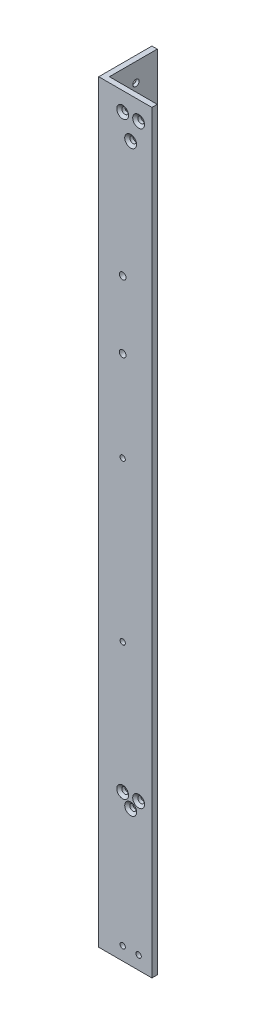
from build123d import *

# Parameters (mm, degrees)
BOSS_EXTRUDE1_DEPTH                               = 450
FRONTSIDEHOLES_SKETCH3_R                          = 1.5875
FRONTSIDEHOLES_SKETCH3_R_2                        = 2
FRONTSIDEHOLES_CUT_EXTRUDE1_DEPTH                 = 3.175
LEFTSIDEHOLES_SKETCH4_R                           = 1.5875
LEFTSIDEHOLES_CUT_EXTRUDE2_DEPTH                  = 3.175
CSK_FOR_6_FLAT_HEAD_MACHINE_SCREW_100_D           = 3.7973
CSK_FOR_6_FLAT_HEAD_MACHINE_SCREW_100_CSINK_D     = 7.0866
CSK_FOR_6_FLAT_HEAD_MACHINE_SCREW_100_CSINK_ANGLE = 100
CSK_FOR_6_FLAT_HEAD_MACHINE_SCREW_2_D             = 3.7973
CSK_FOR_6_FLAT_HEAD_MACHINE_SCREW_2_CSINK_D       = 7.0866
CSK_FOR_6_FLAT_HEAD_MACHINE_SCREW_2_CSINK_ANGLE   = 100


with BuildPart() as part:
    # Sketch2 → Boss-Extrude1 (new body)
    with BuildSketch(Plane(origin=(0, 0, 0), x_dir=(1, 0, 0), z_dir=(0, 1, 0))):
        Polygon((0, 31.75), (3.175, 31.75), (3.175, 3.175), (31.75, 3.175), (31.75, 0), (0, 0), align=None)
    extrude(amount=BOSS_EXTRUDE1_DEPTH)

    # FrontSideHoles-Sketch3 → FrontSideHoles-Cut-Extrude1 (cut)
    with BuildSketch(Plane.XY):
        with Locations((19.05, 81.1125)):
            Circle(FRONTSIDEHOLES_SKETCH3_R)
        with Locations((14.2875, 87.4625)):
            Circle(FRONTSIDEHOLES_SKETCH3_R)
        with Locations((23.8125, 87.4625)):
            Circle(FRONTSIDEHOLES_SKETCH3_R)
        with Locations((14.2875, 438.8875)):
            Circle(FRONTSIDEHOLES_SKETCH3_R)
        with Locations((23.8125, 438.8875)):
            Circle(FRONTSIDEHOLES_SKETCH3_R)
        with Locations((19.05, 426.1875)):
            Circle(FRONTSIDEHOLES_SKETCH3_R)
        with Locations((14.2875, 354.18487)):
            Circle(FRONTSIDEHOLES_SKETCH3_R_2)
        with Locations((14.2875, 313.98487)):
            Circle(FRONTSIDEHOLES_SKETCH3_R_2)
        with Locations((14.2875, 260)):
            Circle(FRONTSIDEHOLES_SKETCH3_R)
        with Locations((14.2875, 165)):
            Circle(FRONTSIDEHOLES_SKETCH3_R)
        with Locations((14.2875, 7.9375)):
            Circle(FRONTSIDEHOLES_SKETCH3_R)
        with Locations((23.8125, 7.9375)):
            Circle(FRONTSIDEHOLES_SKETCH3_R)
    extrude(amount=-FRONTSIDEHOLES_CUT_EXTRUDE1_DEPTH, mode=Mode.SUBTRACT)

    # LeftSideHoles-Sketch4 → LeftSideHoles-Cut-Extrude2 (cut)
    with BuildSketch(Plane.ZY):
        with Locations((-23.8125, 81.1125)):
            Circle(LEFTSIDEHOLES_SKETCH4_R)
        with Locations((-14.2875, 81.1125)):
            Circle(LEFTSIDEHOLES_SKETCH4_R)
        with Locations((-19.05, 87.4625)):
            Circle(LEFTSIDEHOLES_SKETCH4_R)
        with Locations((-19.05, 438.8875)):
            Circle(LEFTSIDEHOLES_SKETCH4_R)
        with Locations((-23.8125, 426.1875)):
            Circle(LEFTSIDEHOLES_SKETCH4_R)
        with Locations((-14.2875, 426.1875)):
            Circle(LEFTSIDEHOLES_SKETCH4_R)
        with Locations((-23.8125, 341.24737)):
            Circle(LEFTSIDEHOLES_SKETCH4_R)
        with Locations((-14.2875, 341.24737)):
            Circle(LEFTSIDEHOLES_SKETCH4_R)
        with Locations((-23.8125, 306.32237)):
            Circle(LEFTSIDEHOLES_SKETCH4_R)
        with Locations((-14.2875, 306.32237)):
            Circle(LEFTSIDEHOLES_SKETCH4_R)
        with Locations((-23.8125, 7.9375)):
            Circle(LEFTSIDEHOLES_SKETCH4_R)
        with Locations((-14.2875, 7.9375)):
            Circle(LEFTSIDEHOLES_SKETCH4_R)
        with Locations((-14.2875, 165)):
            Circle(LEFTSIDEHOLES_SKETCH4_R)
        with Locations((-14.2875, 260)):
            Circle(LEFTSIDEHOLES_SKETCH4_R)
        with Locations((-14.2875, 355)):
            Circle(LEFTSIDEHOLES_SKETCH4_R)
    extrude(amount=-LEFTSIDEHOLES_CUT_EXTRUDE2_DEPTH, mode=Mode.SUBTRACT)

    # CSK for _6 Flat Head Machine Screw _100 (through all)
    with Locations(Plane.XY):
        with Locations((14.2875, 87.4625), (19.05, 81.1125), (23.8125, 87.4625), (19.05, 426.1875), (14.2875, 438.8875), (23.8125, 438.8875)):
            CounterSinkHole(CSK_FOR_6_FLAT_HEAD_MACHINE_SCREW_100_D / 2, CSK_FOR_6_FLAT_HEAD_MACHINE_SCREW_100_CSINK_D / 2, counter_sink_angle=CSK_FOR_6_FLAT_HEAD_MACHINE_SCREW_100_CSINK_ANGLE)

    # CSK for _6 Flat Head Machine Screw _ 2 (through all)
    with Locations(Plane.ZY):
        with Locations((-19.05, 87.4625), (-23.8125, 81.1125), (-14.2875, 81.1125), (-23.8125, 341.24737), (-14.2875, 341.24737), (-14.2875, 306.32237), (-23.8125, 306.32237), (-23.8125, 426.1875), (-14.2875, 426.1875), (-19.05, 438.8875)):
            CounterSinkHole(CSK_FOR_6_FLAT_HEAD_MACHINE_SCREW_2_D / 2, CSK_FOR_6_FLAT_HEAD_MACHINE_SCREW_2_CSINK_D / 2, counter_sink_angle=CSK_FOR_6_FLAT_HEAD_MACHINE_SCREW_2_CSINK_ANGLE)


solid = part.part
